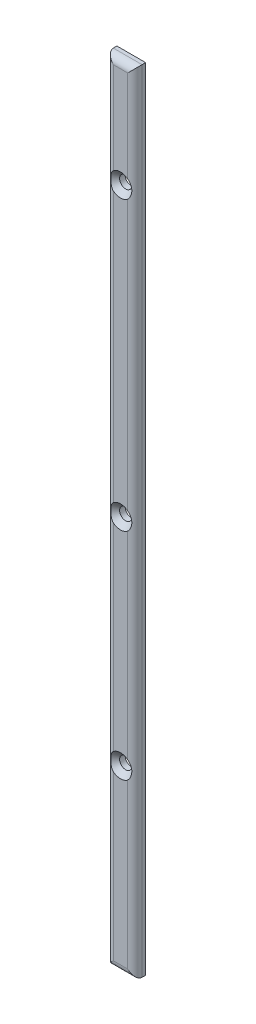
from build123d import *

# Parameters (mm, degrees)
SKETCH_1_W                   = 8
SKETCH_1_H                   = 220
SKETCH_1_R                   = 1.6
EXTRUDE_1_DEPTH              = 3
HOLE_WIZARD_M3_1_D           = 3.4
HOLE_WIZARD_M3_1_DEPTH       = 5
HOLE_WIZARD_M3_1_CSINK_D     = 6.3
HOLE_WIZARD_M3_1_CSINK_ANGLE = 90
HOLE_WIZARD_M3_1_TIP         = 1.021463052
FILLET_1_R                   = 2


with BuildPart() as part:
    # ｽｹｯﾁ1 → ﾎﾞｽ - 押し出し1 (new body)
    with BuildSketch(Plane.XY):
        Rectangle(SKETCH_1_W, SKETCH_1_H)
        with Locations((0, 80)):
            Circle(SKETCH_1_R, mode=Mode.SUBTRACT)
        Circle(SKETCH_1_R, mode=Mode.SUBTRACT)
        with Locations((0, -60)):
            Circle(SKETCH_1_R, mode=Mode.SUBTRACT)
    extrude(amount=EXTRUDE_1_DEPTH)

    # M3 平皿頭ねじ用皿穴1
    with Locations(Plane.XY.offset(3)):
        with Locations((0, -60), (0, 0), (0, 80)):
            CounterSinkHole(HOLE_WIZARD_M3_1_D / 2, HOLE_WIZARD_M3_1_CSINK_D / 2, depth=HOLE_WIZARD_M3_1_DEPTH, counter_sink_angle=HOLE_WIZARD_M3_1_CSINK_ANGLE)
            with Locations((0, 0, -(HOLE_WIZARD_M3_1_DEPTH + HOLE_WIZARD_M3_1_TIP / 2))):  # 118° drill point
                Cone(0, HOLE_WIZARD_M3_1_D / 2, HOLE_WIZARD_M3_1_TIP, mode=Mode.SUBTRACT)

    # ﾌｨﾚｯﾄ1
    # the kernel refuses this fillet: 2 mm, written as the material it takes off along each edge
    with BuildSketch(Plane(origin=(4, 115, 3), x_dir=(-1, 0, 0), z_dir=(0, -1, 0)), Plane(origin=(-4, -115, 3), x_dir=(1, 0, 0), z_dir=(0, 1, 0))) as fillet_1_piece_1:
        with BuildLine():
            CenterArc((FILLET_1_R, FILLET_1_R), FILLET_1_R, 180, 90)
            Line((0, FILLET_1_R), (0, 0))
            Line((0, 0), (FILLET_1_R, 0))
        make_face()
    extrude(amount=230, mode=Mode.SUBTRACT)
    with BuildSketch(Plane(origin=(-9, 110, 3), x_dir=(0, -1, 0), z_dir=(1, 0, 0))) as fillet_1_piece_2:
        with BuildLine():
            CenterArc((FILLET_1_R, FILLET_1_R), FILLET_1_R, 180, 90)
            Line((0, FILLET_1_R), (0, 0))
            Line((0, 0), (FILLET_1_R, 0))
        make_face()
    extrude(amount=18, mode=Mode.SUBTRACT)
    with BuildSketch(Plane(origin=(9, -110, 3), x_dir=(0, 0, -1), z_dir=(-1, 0, 0))) as fillet_1_piece_3:
        with BuildLine():
            CenterArc((FILLET_1_R, -FILLET_1_R), FILLET_1_R, 90, 90)
            Line((0, -FILLET_1_R), (0, 0))
            Line((0, 0), (FILLET_1_R, 0))
        make_face()
    extrude(amount=18, mode=Mode.SUBTRACT)


solid = part.part
